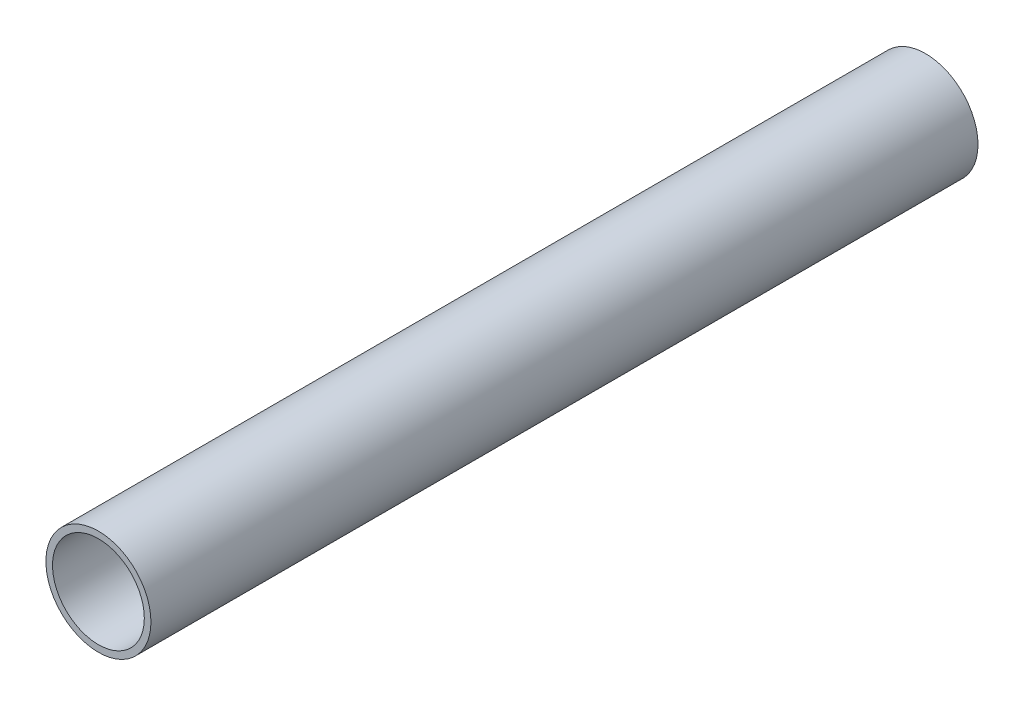
from build123d import *

# Parameters (mm, degrees)
SKETCH1_R           = 12.7
SKETCH1_R_2         = 11.1
BOSS_EXTRUDE1_DEPTH = 200


with BuildPart() as part:
    # Sketch1 → Boss-Extrude1 (new body)
    with BuildSketch(Plane(origin=(0, 0, 0), x_dir=(0, 1, 0), z_dir=(0, 0, 1))):
        Circle(SKETCH1_R)
        Circle(SKETCH1_R_2, mode=Mode.SUBTRACT)
    extrude(amount=BOSS_EXTRUDE1_DEPTH)


solid = part.part
